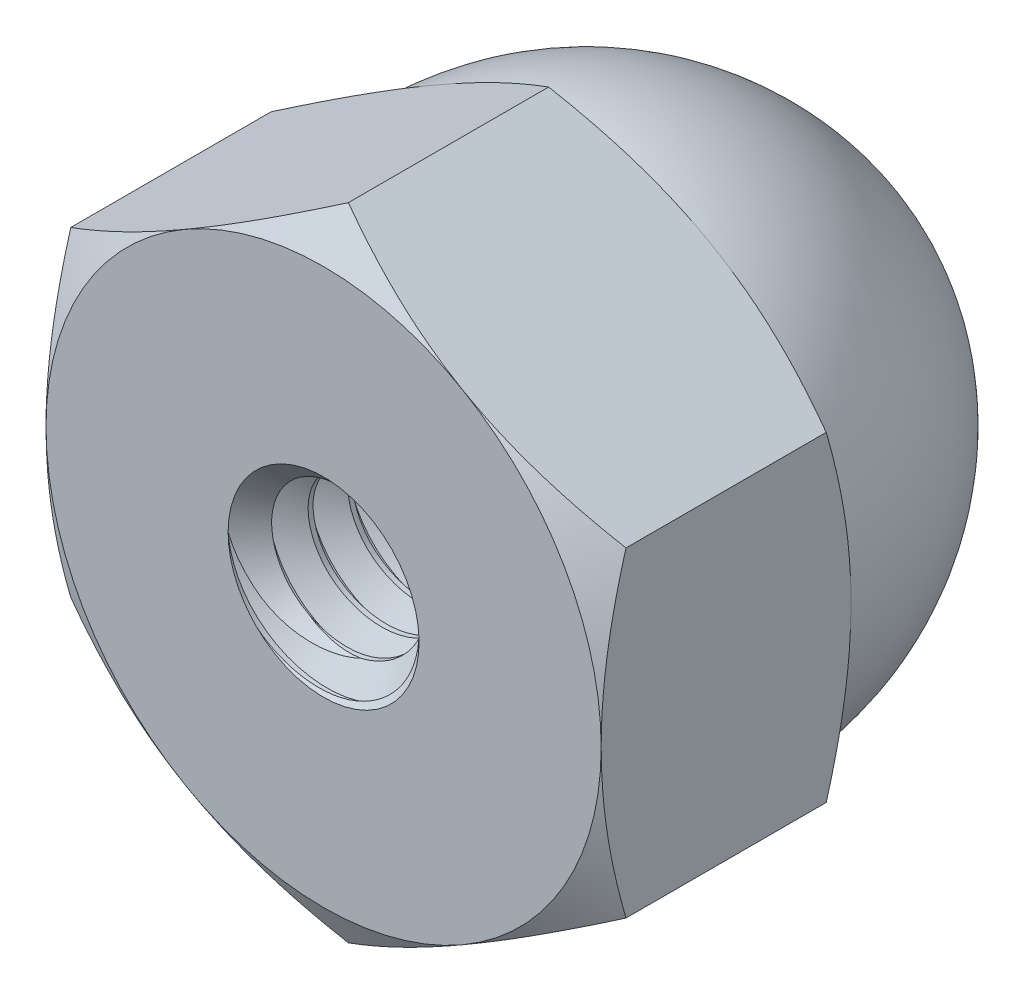
from build123d import *
from build123d.topology import SkipClean

# Parameters (mm, degrees)
EXTRUDE1_DEPTH     = 2.8575
SKETCH2_OUTSIDE_W  = 33.336
SKETCH2_OUTSIDE_H  = 34.318
SKETCH2_OUTSIDE_R  = 3.175
CUT_EXTRUDE1_DEPTH = 6.629099802
CUT_EXTRUDE1_DRAFT = -60
SKETCH3_OUTSIDE_W  = 33.336
SKETCH3_OUTSIDE_H  = 34.318
SKETCH3_OUTSIDE_R  = 3.175
CUT_EXTRUDE2_DEPTH = 6.629099802
CUT_EXTRUDE2_DRAFT = -60
SKETCH4_R          = 1.0922
CUT_EXTRUDE3_DEPTH = 3.96875
SWEEP1_PITCH       = 0.453571429
CUT_EXTRUDE8_DEPTH = 8.990241484


with BuildPart() as part:
    # Sketch1 → Extrude1 (new body)
    with BuildSketch(Plane.XY):
        Polygon((0, 3.666174209), (-3.175, 1.833087105), (-3.175, -1.833087105), (0, -3.666174209), (3.175, -1.833087105), (3.175, 1.833087105), align=None)
    extrude(amount=-EXTRUDE1_DEPTH)


with BuildPart() as cut_extrude1_tool:
    # Sketch2 outside → Cut-Extrude1 (with draft: the straight prism first)
    with BuildSketch(Plane.XY):
        Rectangle(SKETCH2_OUTSIDE_W, SKETCH2_OUTSIDE_H)
        Circle(SKETCH2_OUTSIDE_R, mode=Mode.SUBTRACT)
    extrude(amount=-CUT_EXTRUDE1_DEPTH)
    # Cut-Extrude1: the draft: its side faces are tilted about the plane it starts from
    cut_extrude1_sides = [cut_extrude1_tool.faces().sort_by_distance(p)[0] for p in [
        (0, -17.159, -3.314549901),
        (16.668, 0, -3.314549901),
        (0, 17.159, -3.314549901),
        (-16.668, 0, -3.314549901),
        (-3.175, 0, -3.314549901),
    ]]
    draft(cut_extrude1_sides, Plane.XY, CUT_EXTRUDE1_DRAFT)


with BuildPart() as part_1:
    add(part.part)

    # Cut-Extrude1: cut by cut_extrude1_tool
    add(cut_extrude1_tool.part, mode=Mode.SUBTRACT)


with BuildPart() as cut_extrude2_tool:
    # Sketch3 outside → Cut-Extrude2 (with draft: the straight prism first)
    with BuildSketch(Plane(origin=(0, 0, -2.8575), x_dir=(-1, 0, 0), z_dir=(0, 0, -1))):
        Rectangle(SKETCH3_OUTSIDE_W, SKETCH3_OUTSIDE_H)
        Circle(SKETCH3_OUTSIDE_R, mode=Mode.SUBTRACT)
    extrude(amount=-CUT_EXTRUDE2_DEPTH)
    # Cut-Extrude2: the draft: its side faces are tilted about the plane it starts from
    cut_extrude2_sides = [cut_extrude2_tool.faces().sort_by_distance(p)[0] for p in [
        (0, -17.159, 0.457049901),
        (-16.668, 0, 0.457049901),
        (0, 17.159, 0.457049901),
        (16.668, 0, 0.457049901),
        (3.175, 0, 0.457049901),
    ]]
    draft(cut_extrude2_sides, Plane(origin=(0, 0, -2.8575), x_dir=(-1, 0, 0), z_dir=(0, 0, -1)), CUT_EXTRUDE2_DRAFT)


with BuildPart() as part_2:
    add(part_1.part)

    # Cut-Extrude2: cut by cut_extrude2_tool
    add(cut_extrude2_tool.part, mode=Mode.SUBTRACT)

    # Sketch14 → Revolve1 (revolve)
    with BuildSketch(Plane(origin=(0, 0, 0), x_dir=(0, 0, -1), z_dir=(1, 0, 0))):
        with BuildLine():
            Line((2.8575, 3.175), (2.8575, 0))
            Line((2.8575, 0), (6.35, 0))
            ThreePointArc((6.35, 0), (5.217488414, 2.262612255), (2.8575, 3.175))
        make_face()
    revolve(axis=Axis((0, 0, 0), (0, 0, -1)))

    # Sketch4 → Cut-Extrude3 (cut)
    with BuildSketch(Plane.XY):
        Circle(SKETCH4_R)
    extrude(amount=-CUT_EXTRUDE3_DEPTH, mode=Mode.SUBTRACT)

    # Sweep1: arcs per turn and ends read off the stored shape
    # Sweep1: the profile of Sketch16 profile screwed along a left-hand helix through 16 turns, 6 arcs to a turn; built about Z, then put on its axis
    sweep1_z = Axis((0, 0, 0), (0, 0, 1))
    sweep1_corners = [(1.0925, 0, 0.000173205), (1.0925, 0, -0.397048205), (0.797596715, 0, -0.226785714), (0.797596715, 0, -0.170089286)]
    with BuildLine(mode=Mode.PRIVATE) as sweep1_profile:
        Line(sweep1_corners[0], sweep1_corners[1])
        Line(sweep1_corners[1], sweep1_corners[2])
        Line(sweep1_corners[2], sweep1_corners[3])
        Line(sweep1_corners[3], sweep1_corners[0])
    sweep1_cap = Face(sweep1_profile.wire())
    sweep1_turn_angles = [0, -30, -60, -90, -120, -150, -180, -210, -240, -270, -300, -330, -360]
    sweep1_turn_weights = [1, 0.8660254037844387, 1, 0.8660254037844387, 1, 0.8660254037844387, 1, 0.8660254037844387, 1, 0.8660254037844387, 1, 0.8660254037844387, 1]
    sweep1_turn_rails = [Edge.make_bspline([Vector(p[0], p[1], 0).rotate(sweep1_z, sweep1_turn_angles[k]) / sweep1_turn_weights[k] + Vector(0, 0, p[2] + -SWEEP1_PITCH * sweep1_turn_angles[k] / 360) for k in range(13)], [0, 0, 0, 1, 1, 2, 2, 3, 3, 4, 4, 5, 5, 6, 6, 6], 2, sweep1_turn_weights) for p in sweep1_corners]
    sweep1_turn_sides = [Face.make_surface_from_curves(sweep1_turn_rails[p[0]], sweep1_turn_rails[p[1]]) for p in [(0, 1), (1, 2), (2, 3), (3, 0)]]
    sweep1 = Plane(origin=(0, 0, -3.96875), x_dir=(0, 1, 0), z_dir=(0, 0, 1)) * Solid(Shell([*[p.moved(Location((0, 0, SWEEP1_PITCH * i))) for i in range(16) for p in sweep1_turn_sides], sweep1_cap, sweep1_cap.rotate(sweep1_z, -5760).moved(Location((0, 0, -SWEEP1_PITCH * -5760 / 360)))]))
    add(sweep1)

    # Sketch17 → Cut-Extrude8 (cut, through all)
    with BuildSketch(Plane.XY):
        Polygon((0, 3.666174209), (-3.175, 1.833087105), (-3.175, -1.833087105), (0, -3.666174209), (3.175, -1.833087105), (3.175, 1.833087105), align=None)
    extrude(amount=CUT_EXTRUDE8_DEPTH, mode=Mode.SUBTRACT)

    # Cut-Extrude9 cone 1 section (through the dimple's axis) → Cut-Extrude9 (revolve, cut)
    with BuildSketch(Plane(origin=(0, 0, 0), x_dir=(0, -1, 0), z_dir=(1, 0, 0))):
        Polygon((0, 0), (1.0922, 0), (0, 1.0922), align=None)
    revolve(axis=Axis((0, 0, 0), (0, 0, -1)), mode=Mode.SUBTRACT)

    # Sketch20 → Cut-Revolve1 (revolve, cut)
    with SkipClean():  # the faces are left unmerged after this step: merging them gives an invalid solid
        with BuildSketch(Plane(origin=(0, 0, 0), x_dir=(0, 0, -1), z_dir=(1, 0, 0)), mode=Mode.PRIVATE) as cut_revolve1_sk:
            Polygon((4.195535714, 1.0922), (4.826117678, 0), (3.96875, 0), (3.96875, 1.0922), align=None)
        revolve(cut_revolve1_sk.sketch.rotate(Axis((0, 0, 0), (0, 0, 1)), 90), axis=Axis((0, 0, 0), (0, 0, 1)), mode=Mode.SUBTRACT)
    add(part_2.part.scale(1), mode=Mode.REPLACE)  # the faces are merged on a copy


solid = part_2.part
